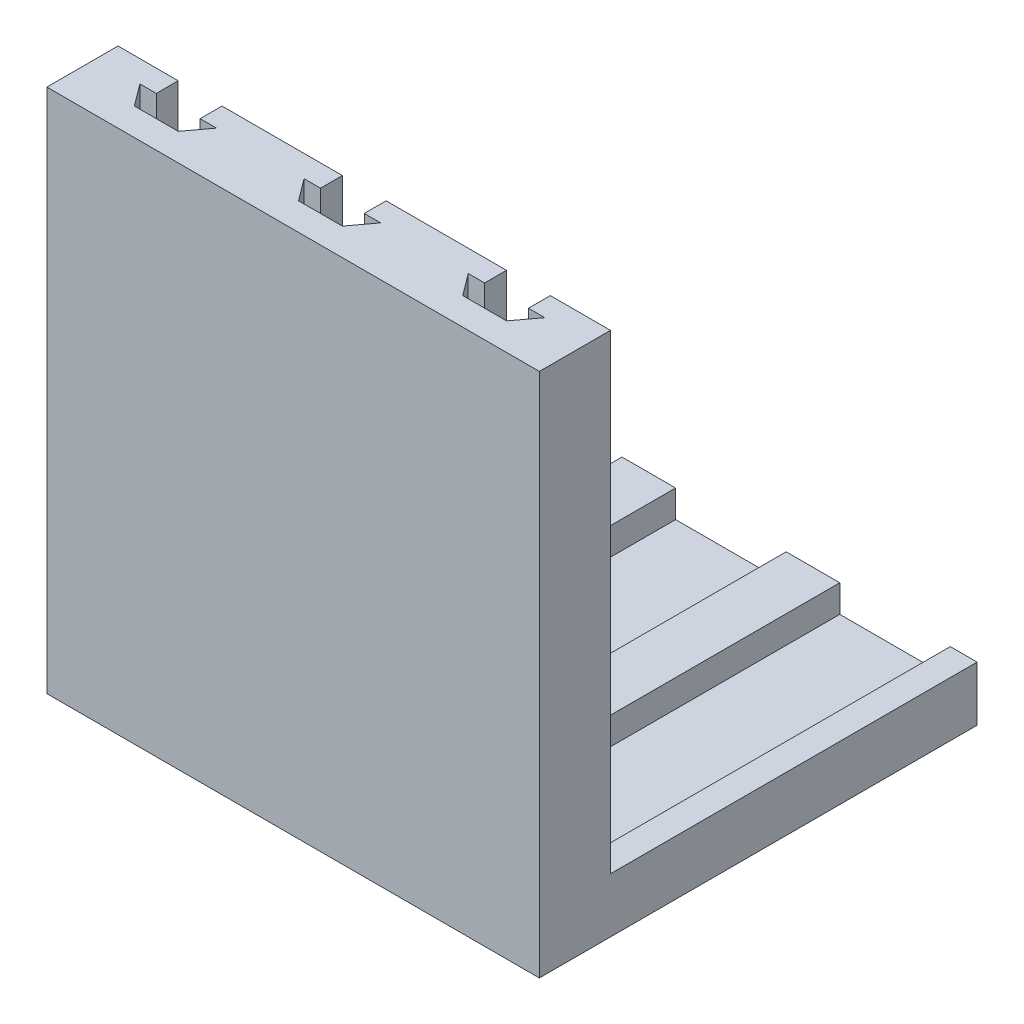
from build123d import *

# Parameters (mm, degrees)
SKETCH1_W           = 30
SKETCH1_H           = 80
BOSS_EXTRUDE1_DEPTH = 10
SKETCH2_W           = 30
SKETCH2_H           = 13
BOSS_EXTRUDE2_DEPTH = 86
CUT_EXTRUDE1_DEPTH  = 40
SKETCH4_W           = 20.2
SKETCH4_H           = 67
CUT_EXTRUDE2_DEPTH  = 5
SKETCH5_W           = 8
SKETCH5_H           = 2
CUT_EXTRUDE3_DEPTH  = 51
LPATTERN1_COUNT     = 3
LPATTERN1_PITCH     = 30


with BuildPart() as part:
    # Sketch1 → Boss-Extrude1 (new body)
    with BuildSketch(Plane(origin=(0, 0, 0), x_dir=(1, 0, 0), z_dir=(0, 1, 0))):
        Rectangle(SKETCH1_W, SKETCH1_H)
    boss_extrude1 = extrude(amount=BOSS_EXTRUDE1_DEPTH)

    # Sketch2 → Boss-Extrude2 (add)
    with BuildSketch(Plane(origin=(0, 10, 0), x_dir=(1, 0, 0), z_dir=(0, 1, 0))):
        with Locations((0, -33.5)):
            Rectangle(SKETCH2_W, SKETCH2_H)
    boss_extrude2 = extrude(amount=BOSS_EXTRUDE2_DEPTH)

    # Sketch3 → Cut-Extrude1 (cut)
    with BuildSketch(Plane(origin=(0, 96, 0), x_dir=(1, 0, 0), z_dir=(0, 1, 0))):
        Polygon((-4, -27), (4, -27), (4, -31), (7, -31), (4, -35), (-4, -35), (-7, -31), (-4, -31), align=None)
    cut_extrude1 = extrude(amount=-CUT_EXTRUDE1_DEPTH, mode=Mode.SUBTRACT)

    # Sketch4 → Cut-Extrude2 (cut)
    with BuildSketch(Plane(origin=(0, 10, 0), x_dir=(1, 0, 0), z_dir=(0, 1, 0))):
        with Locations((0, 6.5)):
            Rectangle(SKETCH4_W, SKETCH4_H)
    cut_extrude2 = extrude(amount=-CUT_EXTRUDE2_DEPTH, mode=Mode.SUBTRACT)

    # Sketch5 → Cut-Extrude3 (cut)
    with BuildSketch(Plane(origin=(0, 56, 0), x_dir=(1, 0, 0), z_dir=(0, 1, 0))):
        with Locations((0, -28)):
            Rectangle(SKETCH5_W, SKETCH5_H)
    cut_extrude3 = extrude(amount=-CUT_EXTRUDE3_DEPTH, mode=Mode.SUBTRACT)

    # LPattern1: Boss-Extrude1, Boss-Extrude2, Cut-Extrude1, Cut-Extrude2, Cut-Extrude3 ×3
    with Locations(*[(-i * LPATTERN1_PITCH, 0, 0) for i in range(1, LPATTERN1_COUNT)]):
        add(boss_extrude1)
        add(boss_extrude2)
        add(cut_extrude1, mode=Mode.SUBTRACT)
        add(cut_extrude2, mode=Mode.SUBTRACT)
        add(cut_extrude3, mode=Mode.SUBTRACT)


solid = part.part
